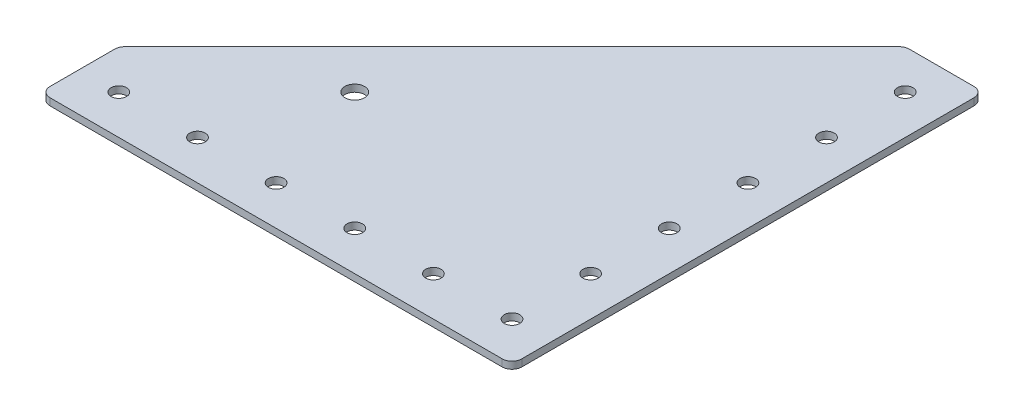
from build123d import *

# Parameters (mm, degrees)
SKETCH1_R           = 2.4892
SKETCH1_R_2         = 3.175
BOSS_EXTRUDE2_DEPTH = 1.143
FILLET1_R           = 3.175
FILLET2_R           = 3.175


with BuildPart() as part:
    # Sketch1 → Boss-Extrude2 (new, symmetric)
    with BuildSketch(Plane(origin=(0, 0, 0), x_dir=(1, 0, 0), z_dir=(0, 1, 0))):
        Polygon((0, 0), (0, 152.4), (-25.4, 152.4), (-152.4, 25.4), (-152.4, 0), align=None)
        with Locations((-12.7, 12.7)):
            Circle(SKETCH1_R, mode=Mode.SUBTRACT)
        with Locations((-38.1, 12.7)):
            Circle(SKETCH1_R, mode=Mode.SUBTRACT)
        with Locations((-63.5, 12.7)):
            Circle(SKETCH1_R, mode=Mode.SUBTRACT)
        with Locations((-88.9, 12.7)):
            Circle(SKETCH1_R, mode=Mode.SUBTRACT)
        with Locations((-114.3, 12.7)):
            Circle(SKETCH1_R, mode=Mode.SUBTRACT)
        with Locations((-12.7, 38.1)):
            Circle(SKETCH1_R, mode=Mode.SUBTRACT)
        with Locations((-12.7, 63.5)):
            Circle(SKETCH1_R, mode=Mode.SUBTRACT)
        with Locations((-12.7, 88.9)):
            Circle(SKETCH1_R, mode=Mode.SUBTRACT)
        with Locations((-12.7, 114.3)):
            Circle(SKETCH1_R, mode=Mode.SUBTRACT)
        with Locations((-139.7, 12.7)):
            Circle(SKETCH1_R, mode=Mode.SUBTRACT)
        with Locations((-12.7, 139.7)):
            Circle(SKETCH1_R, mode=Mode.SUBTRACT)
        with Locations((-101.6, 50.8)):
            Circle(SKETCH1_R_2, mode=Mode.SUBTRACT)
    extrude(amount=BOSS_EXTRUDE2_DEPTH, both=True)

    # Fillet1
    fillet1_edges = [part.edges().sort_by_distance(p)[0] for p in [
        (0, 0, 0),
        (-152.4, 0, 0),
    ]]
    fillet(fillet1_edges, radius=FILLET1_R)

    # Fillet2
    fillet2_edges = [part.edges().sort_by_distance(p)[0] for p in [
        (-152.4, 0, -25.4),
        (-25.4, 0, -152.4),
        (0, 0, -152.4),
    ]]
    fillet(fillet2_edges, radius=FILLET2_R)


solid = part.part
